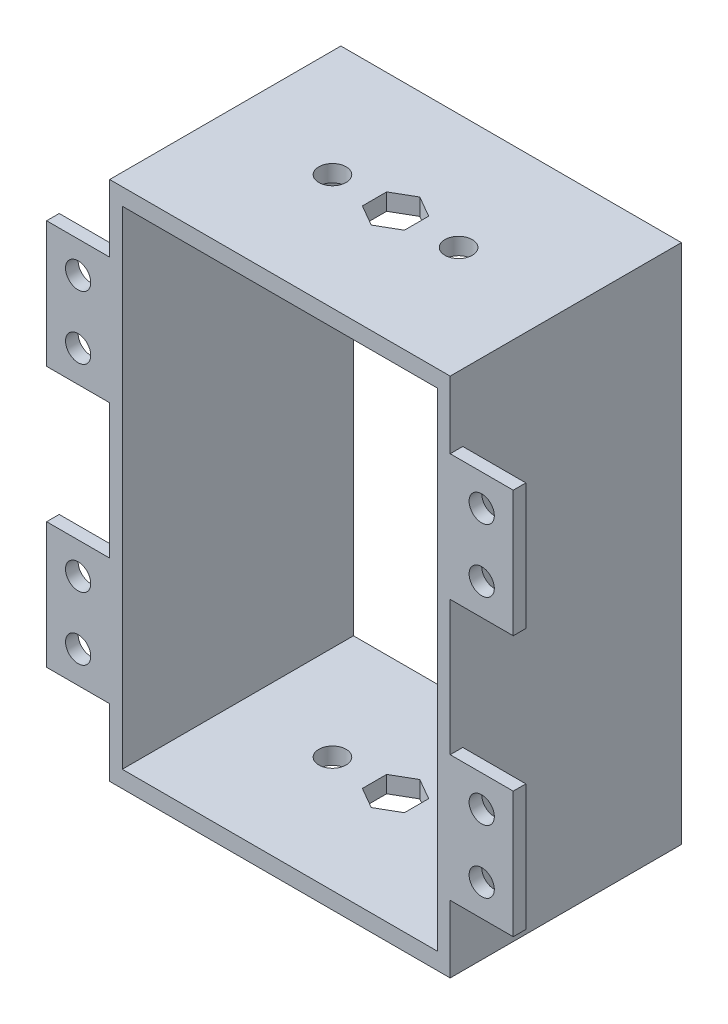
from build123d import *

# Parameters (mm, degrees)
SKETCH1_W           = 75
SKETCH1_H           = 55
SKETCH1_R           = 3.25
BOSS_EXTRUDE1_DEPTH = 4
SKETCH2_W           = 55
SKETCH2_H           = 120
BOSS_EXTRUDE2_DEPTH = 3
SKETCH3_W           = 81
SKETCH3_H           = 55
SKETCH3_R           = 3.25
BOSS_EXTRUDE3_DEPTH = 4
SKETCH5_W           = 15
SKETCH5_H           = 30
SKETCH5_R           = 3
BOSS_EXTRUDE5_DEPTH = 3


with BuildPart() as part:
    # Sketch1 → Boss-Extrude1 (new body)
    with BuildSketch(Plane(origin=(0, 0, 0), x_dir=(1, 0, 0), z_dir=(0, 1, 0))):
        with Locations((37.5, 27.5)):
            Rectangle(SKETCH1_W, SKETCH1_H)
        with Locations((22.5, 27.5)):
            Circle(SKETCH1_R, mode=Mode.SUBTRACT)
        with Locations((52.5, 27.5)):
            Circle(SKETCH1_R, mode=Mode.SUBTRACT)
        Polygon((37.5, 33.273502692), (32.5, 30.386751346), (32.5, 24.613248654), (37.5, 21.726497308), (42.5, 24.613248654), (42.5, 30.386751346), align=None, mode=Mode.SUBTRACT)
    extrude(amount=BOSS_EXTRUDE1_DEPTH)

    # Sketch2 → Boss-Extrude2 (add)
    with BuildSketch(Plane.ZY):
        with Locations((-27.5, 60)):
            Rectangle(SKETCH2_W, SKETCH2_H)
    boss_extrude2 = extrude(amount=BOSS_EXTRUDE2_DEPTH)

    # Mirror1: Boss-Extrude2 across plane
    add(boss_extrude2.mirror(Plane(origin=(37.5, 0, 0), x_dir=(0, 0, 1), z_dir=(1, 0, 0))))

    # Sketch3 → Boss-Extrude3 (add)
    with BuildSketch(Plane(origin=(0, 120, 0), x_dir=(1, 0, 0), z_dir=(0, 1, 0))):
        with Locations((37.5, 27.5)):
            Rectangle(SKETCH3_W, SKETCH3_H)
        with Locations((22.5, 27.5)):
            Circle(SKETCH3_R, mode=Mode.SUBTRACT)
        with Locations((52.5, 27.5)):
            Circle(SKETCH3_R, mode=Mode.SUBTRACT)
        Polygon((37.5, 33.273502692), (32.5, 30.386751346), (32.5, 24.613248654), (37.5, 21.726497308), (42.5, 24.613248654), (42.5, 30.386751346), align=None, mode=Mode.SUBTRACT)
    extrude(amount=BOSS_EXTRUDE3_DEPTH)

    # Sketch5 → Boss-Extrude5 (add)
    # profile 1 of 2: a face of its own
    with BuildSketch(Plane.XY):
        with Locations((-10.5, 93)):
            Rectangle(SKETCH5_W, SKETCH5_H)
        with Locations((-10.5, 100.5)):
            Circle(SKETCH5_R, mode=Mode.SUBTRACT)
        with Locations((-10.5, 85.5)):
            Circle(SKETCH5_R, mode=Mode.SUBTRACT)
    # profile 2 of 2: a face of its own
    with BuildSketch(Plane.XY):
        with Locations((-10.5, 31)):
            Rectangle(SKETCH5_W, SKETCH5_H)
        with Locations((-10.5, 38.5)):
            Circle(SKETCH5_R, mode=Mode.SUBTRACT)
        with Locations((-10.5, 23.5)):
            Circle(SKETCH5_R, mode=Mode.SUBTRACT)
    boss_extrude5 = extrude(amount=-BOSS_EXTRUDE5_DEPTH)

    # Mirror2: Boss-Extrude5 across plane
    add(boss_extrude5.mirror(Plane(origin=(37.5, 0, 0), x_dir=(0, 0, 1), z_dir=(1, 0, 0))))


solid = part.part
